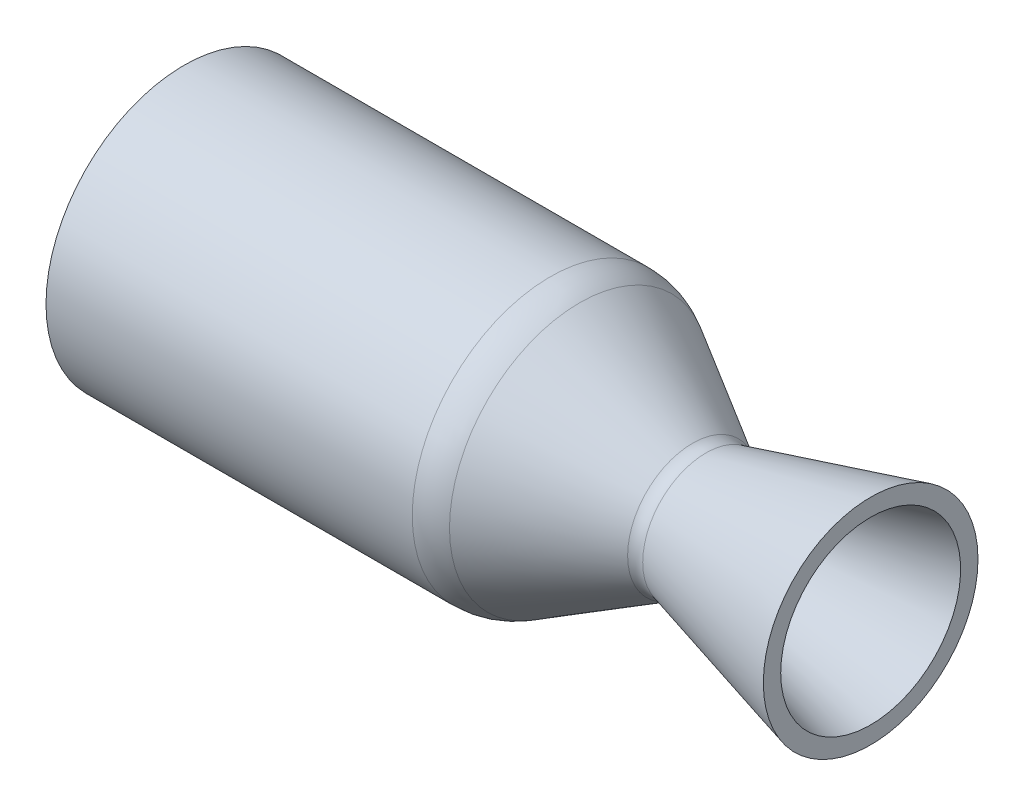
from build123d import *


with BuildPart() as part:
    # Sketch1 → Revolve1 (revolve)
    with BuildSketch(Plane.XY):
        with BuildLine():
            Line((0, 36.703), (110.897045256, 36.703))
            ThreePointArc((110.897045256, 36.703), (114.184047129, 36.270257994), (117.247045256, 35.001522628))
            Line((117.247045256, 35.001522628), (151.437057306, 15.261909968))
            ThreePointArc((151.437057306, 15.261909968), (155.280065223, 13.957384563), (159.32976184, 14.222815703))
            Line((159.32976184, 14.222815703), (207.906673675, 27.23896))
            Line((207.906673675, 27.23896), (207.906673675, 32.498162996))
            Line((207.906673675, 32.498162996), (158.01496109, 19.129718901))
            ThreePointArc((158.01496109, 19.129718901), (155.943138279, 18.993924459), (153.977057306, 19.661319019))
            Line((153.977057306, 19.661319019), (119.787045256, 39.400931679))
            ThreePointArc((119.787045256, 39.400931679), (115.498847878, 41.177161191), (110.897045256, 41.783))
            Line((110.897045256, 41.783), (0, 41.783))
            Line((0, 41.783), (0, 36.703))
        make_face()
    revolve(axis=Axis((0, 0, 0), (1, 0, 0)))


solid = part.part
